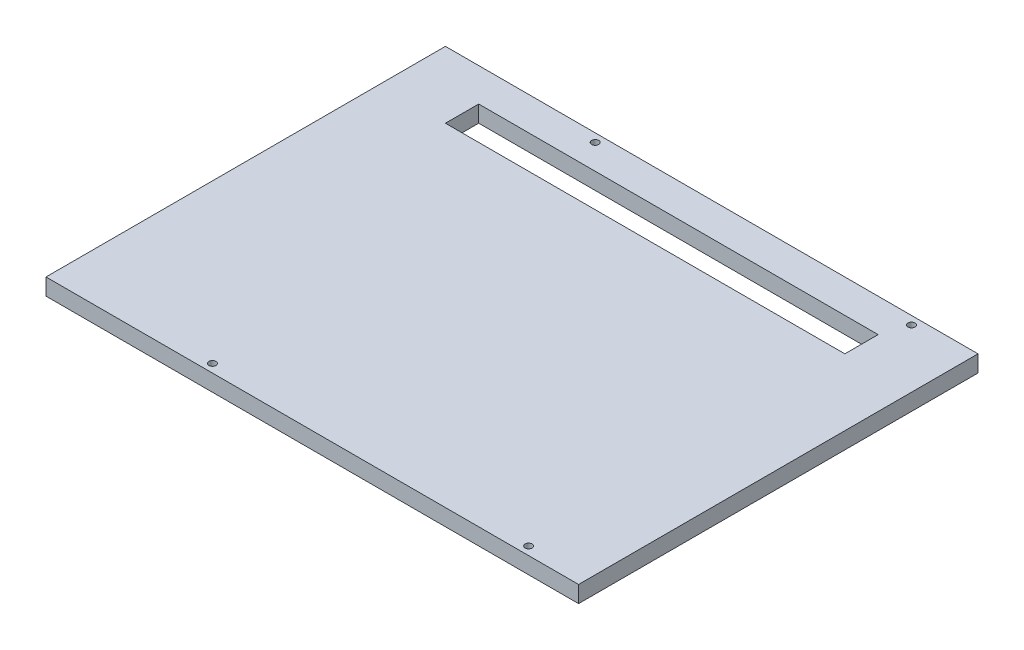
from build123d import *

# Parameters (mm, degrees)
SKETCH2_W                 = 203.2
SKETCH2_H                 = 152.4
BOSS_EXTRUDE1_DEPTH       = 6.35
SKETCH3_W                 = 152.4
SKETCH3_H                 = 12.7
CUT_EXTRUDE1_DEPTH        = 6.35
F_6_32_TAPPED_HOLE1_D     = 2.7051
F_6_32_TAPPED_HOLE1_DEPTH = 12.7
F_6_32_TAPPED_HOLE1_TIP   = 0.81269403


with BuildPart() as part:
    # Sketch2 → Boss-Extrude1 (new body)
    with BuildSketch(Plane(origin=(0, 0, 0), x_dir=(1, 0, 0), z_dir=(0, 1, 0))):
        Rectangle(SKETCH2_W, SKETCH2_H)
    extrude(amount=BOSS_EXTRUDE1_DEPTH)

    # Sketch3 → Cut-Extrude1 (cut)
    with BuildSketch(Plane(origin=(0, 6.35, 0), x_dir=(1, 0, 0), z_dir=(0, 1, 0))):
        with Locations((0, 57.15)):
            Rectangle(SKETCH3_W, SKETCH3_H)
    extrude(amount=-CUT_EXTRUDE1_DEPTH, mode=Mode.SUBTRACT)

    # #6-32 Tapped Hole1
    with Locations(Plane(origin=(0, 6.35, 0), x_dir=(1, 0, 0), z_dir=(0, 1, 0))):
        with Locations((-41.275, -73.025), (-41.275, 73.025), (79.375, 73.025), (79.375, -73.025)):
            Hole(F_6_32_TAPPED_HOLE1_D / 2, depth=F_6_32_TAPPED_HOLE1_DEPTH)
            with Locations((0, 0, -(F_6_32_TAPPED_HOLE1_DEPTH + F_6_32_TAPPED_HOLE1_TIP / 2))):  # 118° drill point
                Cone(0, F_6_32_TAPPED_HOLE1_D / 2, F_6_32_TAPPED_HOLE1_TIP, mode=Mode.SUBTRACT)


solid = part.part
